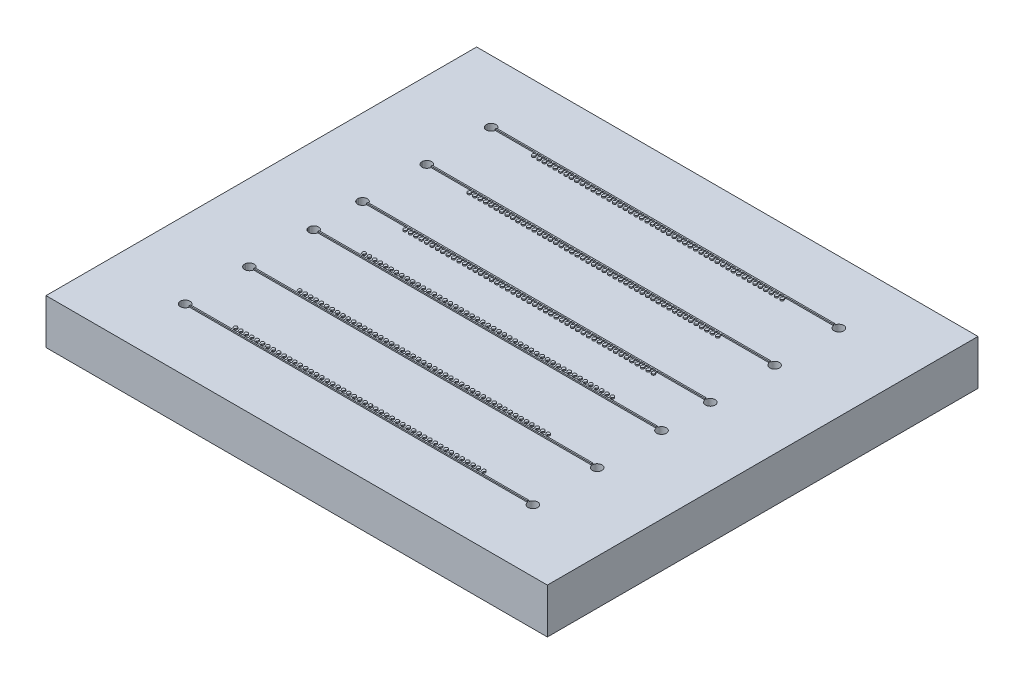
from build123d import *

# Parameters (mm, degrees)
SKETCH1_W            = 39
SKETCH1_H            = 33.5
BOSS_EXTRUDE1_DEPTH  = 3.5
BOSS_EXTRUDE3_DEPTH  = 0.1
CUT_EXTRUDE1_REACH   = 27.943
LPATTERN3_COUNT      = 3
LPATTERN3_PITCH      = 5
MIRROR1_COPY_1_DEPTH = 0.1
MIRROR1_COPY_2_DEPTH = 0.1
MIRROR1_COPY_3_REACH = 27.943
MIRROR1_COPY_4_REACH = 27.943
MIRROR1_COPY_5_DEPTH = 0.1
MIRROR1_COPY_6_REACH = 27.943


with BuildPart() as part:
    # Sketch1 → Boss-Extrude1 (new body)
    with BuildSketch(Plane(origin=(0, 0, 0), x_dir=(1, 0, 0), z_dir=(0, 1, 0))):
        Rectangle(SKETCH1_W, SKETCH1_H)
    extrude(amount=BOSS_EXTRUDE1_DEPTH)

    # Sketch2 → Boss-Extrude3 (add)
    with BuildSketch(Plane(origin=(0, 3.5, 0), x_dir=(1, 0, 0), z_dir=(0, 1, 0))):
        with BuildLine():
            Line((-9.02, 11.71), (-9.02, 11.85))
            Line((-9.02, 11.85), (-8.7, 11.85))
            Line((-8.7, 11.85), (-8.7, 11.71))
            ThreePointArc((-8.7, 11.71), (-8.65, 11.472527536), (-8.6, 11.71))
            Line((-8.6, 11.71), (-8.6, 11.85))
            Line((-8.6, 11.85), (-8.28, 11.85))
            Line((-8.28, 11.85), (-8.28, 11.71))
            ThreePointArc((-8.28, 11.71), (-8.23, 11.472527536), (-8.18, 11.71))
            Line((-8.18, 11.71), (-8.18, 11.85))
            Line((-8.18, 11.85), (-7.86, 11.85))
            Line((-7.86, 11.85), (-7.86, 11.71))
            ThreePointArc((-7.86, 11.71), (-7.81, 11.472527536), (-7.76, 11.71))
            Line((-7.76, 11.71), (-7.76, 11.85))
            Line((-7.76, 11.85), (-7.44, 11.85))
            Line((-7.44, 11.85), (-7.44, 11.71))
            ThreePointArc((-7.44, 11.71), (-7.39, 11.472527536), (-7.34, 11.71))
            Line((-7.34, 11.71), (-7.34, 11.85))
            Line((-7.34, 11.85), (-7.02, 11.85))
            Line((-7.02, 11.85), (-7.02, 11.71))
            ThreePointArc((-7.02, 11.71), (-6.97, 11.472527536), (-6.92, 11.71))
            Line((-6.92, 11.71), (-6.92, 11.85))
            Line((-6.92, 11.85), (-6.6, 11.85))
            Line((-6.6, 11.85), (-6.6, 11.71))
            ThreePointArc((-6.6, 11.71), (-6.55, 11.472527536), (-6.5, 11.71))
            Line((-6.5, 11.71), (-6.5, 11.85))
            Line((-6.5, 11.85), (-6.18, 11.85))
            Line((-6.18, 11.85), (-6.18, 11.71))
            ThreePointArc((-6.18, 11.71), (-6.13, 11.472527536), (-6.08, 11.71))
            Line((-6.08, 11.71), (-6.08, 11.85))
            Line((-6.08, 11.85), (-5.76, 11.85))
            Line((-5.76, 11.85), (-5.76, 11.71))
            ThreePointArc((-5.76, 11.71), (-5.71, 11.472527536), (-5.66, 11.71))
            Line((-5.66, 11.71), (-5.66, 11.85))
            Line((-5.66, 11.85), (-5.34, 11.85))
            Line((-5.34, 11.85), (-5.34, 11.71))
            ThreePointArc((-5.34, 11.71), (-5.29, 11.472527536), (-5.24, 11.71))
            Line((-5.24, 11.71), (-5.24, 11.85))
            Line((-5.24, 11.85), (-4.92, 11.85))
            Line((-4.92, 11.85), (-4.92, 11.71))
            ThreePointArc((-4.92, 11.71), (-4.87, 11.472527536), (-4.82, 11.71))
            Line((-4.82, 11.71), (-4.82, 11.85))
            Line((-4.82, 11.85), (-4.5, 11.85))
            Line((-4.5, 11.85), (-4.5, 11.71))
            ThreePointArc((-4.5, 11.71), (-4.45, 11.472527536), (-4.4, 11.71))
            Line((-4.4, 11.71), (-4.4, 11.85))
            Line((-4.4, 11.85), (-4.08, 11.85))
            Line((-4.08, 11.85), (-4.08, 11.71))
            ThreePointArc((-4.08, 11.71), (-4.03, 11.472527536), (-3.98, 11.71))
            Line((-3.98, 11.71), (-3.98, 11.85))
            Line((-3.98, 11.85), (-3.66, 11.85))
            Line((-3.66, 11.85), (-3.66, 11.71))
            ThreePointArc((-3.66, 11.71), (-3.61, 11.472527536), (-3.56, 11.71))
            Line((-3.56, 11.71), (-3.56, 11.85))
            Line((-3.56, 11.85), (-3.24, 11.85))
            Line((-3.24, 11.85), (-3.24, 11.71))
            ThreePointArc((-3.24, 11.71), (-3.19, 11.472527536), (-3.14, 11.71))
            Line((-3.14, 11.71), (-3.14, 11.85))
            Line((-3.14, 11.85), (-2.82, 11.85))
            Line((-2.82, 11.85), (-2.82, 11.71))
            ThreePointArc((-2.82, 11.71), (-2.77, 11.472527536), (-2.72, 11.71))
            Line((-2.72, 11.71), (-2.72, 11.85))
            Line((-2.72, 11.85), (-2.4, 11.85))
            Line((-2.4, 11.85), (-2.4, 11.71))
            ThreePointArc((-2.4, 11.71), (-2.35, 11.472527536), (-2.3, 11.71))
            Line((-2.3, 11.71), (-2.3, 11.85))
            Line((-2.3, 11.85), (-1.98, 11.85))
            Line((-1.98, 11.85), (-1.98, 11.71))
            ThreePointArc((-1.98, 11.71), (-1.93, 11.472527536), (-1.88, 11.71))
            Line((-1.88, 11.71), (-1.88, 11.85))
            Line((-1.88, 11.85), (-1.56, 11.85))
            Line((-1.56, 11.85), (-1.56, 11.71))
            ThreePointArc((-1.56, 11.71), (-1.51, 11.472527536), (-1.46, 11.71))
            Line((-1.46, 11.71), (-1.46, 11.85))
            Line((-1.46, 11.85), (-1.14, 11.85))
            Line((-1.14, 11.85), (-1.14, 11.71))
            ThreePointArc((-1.14, 11.71), (-1.09, 11.472527536), (-1.04, 11.71))
            Line((-1.04, 11.71), (-1.04, 11.85))
            Line((-1.04, 11.85), (-0.72, 11.85))
            Line((-0.72, 11.85), (-0.72, 11.71))
            ThreePointArc((-0.72, 11.71), (-0.67, 11.472527536), (-0.62, 11.71))
            Line((-0.62, 11.71), (-0.62, 11.85))
            Line((-0.62, 11.85), (-0.3, 11.85))
            Line((-0.3, 11.85), (-0.3, 11.71))
            ThreePointArc((-0.3, 11.71), (-0.25, 11.472527536), (-0.2, 11.71))
            Line((-0.2, 11.71), (-0.2, 11.85))
            Line((-0.2, 11.85), (0.12, 11.85))
            Line((0.12, 11.85), (0.12, 11.71))
            ThreePointArc((0.12, 11.71), (0.17, 11.472527536), (0.22, 11.71))
            Line((0.22, 11.71), (0.22, 11.85))
            Line((0.22, 11.85), (0.54, 11.85))
            Line((0.54, 11.85), (0.54, 11.71))
            ThreePointArc((0.54, 11.71), (0.59, 11.472527536), (0.64, 11.71))
            Line((0.64, 11.71), (0.64, 11.85))
            Line((0.64, 11.85), (0.96, 11.85))
            Line((0.96, 11.85), (0.96, 11.71))
            ThreePointArc((0.96, 11.71), (1.01, 11.472527536), (1.06, 11.71))
            Line((1.06, 11.71), (1.06, 11.85))
            Line((1.06, 11.85), (1.38, 11.85))
            Line((1.38, 11.85), (1.38, 11.71))
            ThreePointArc((1.38, 11.71), (1.43, 11.472527536), (1.48, 11.71))
            Line((1.48, 11.71), (1.48, 11.85))
            Line((1.48, 11.85), (1.8, 11.85))
            Line((1.8, 11.85), (1.8, 11.71))
            ThreePointArc((1.8, 11.71), (1.85, 11.472527536), (1.9, 11.71))
            Line((1.9, 11.71), (1.9, 11.85))
            Line((1.9, 11.85), (2.22, 11.85))
            Line((2.22, 11.85), (2.22, 11.71))
            ThreePointArc((2.22, 11.71), (2.27, 11.472527536), (2.32, 11.71))
            Line((2.32, 11.71), (2.32, 11.85))
            Line((2.32, 11.85), (2.64, 11.85))
            Line((2.64, 11.85), (2.64, 11.71))
            ThreePointArc((2.64, 11.71), (2.69, 11.472527536), (2.74, 11.71))
            Line((2.74, 11.71), (2.74, 11.85))
            Line((2.74, 11.85), (3.06, 11.85))
            Line((3.06, 11.85), (3.06, 11.71))
            ThreePointArc((3.06, 11.71), (3.11, 11.472527536), (3.16, 11.71))
            Line((3.16, 11.71), (3.16, 11.85))
            Line((3.16, 11.85), (3.48, 11.85))
            Line((3.48, 11.85), (3.48, 11.71))
            ThreePointArc((3.48, 11.71), (3.53, 11.472527536), (3.58, 11.71))
            Line((3.58, 11.71), (3.58, 11.85))
            Line((3.58, 11.85), (3.9, 11.85))
            Line((3.9, 11.85), (3.9, 11.71))
            ThreePointArc((3.9, 11.71), (3.95, 11.472527536), (4, 11.71))
            Line((4, 11.71), (4, 11.85))
            Line((4, 11.85), (4.32, 11.85))
            Line((4.32, 11.85), (4.32, 11.71))
            ThreePointArc((4.32, 11.71), (4.37, 11.472527536), (4.42, 11.71))
            Line((4.42, 11.71), (4.42, 11.85))
            Line((4.42, 11.85), (4.74, 11.85))
            Line((4.74, 11.85), (4.74, 11.71))
            ThreePointArc((4.74, 11.71), (4.79, 11.472527536), (4.84, 11.71))
            Line((4.84, 11.71), (4.84, 11.85))
            Line((4.84, 11.85), (5.16, 11.85))
            Line((5.16, 11.85), (5.16, 11.71))
            ThreePointArc((5.16, 11.71), (5.21, 11.472527536), (5.26, 11.71))
            Line((5.26, 11.71), (5.26, 11.85))
            Line((5.26, 11.85), (5.58, 11.85))
            Line((5.58, 11.85), (5.58, 11.71))
            ThreePointArc((5.58, 11.71), (5.63, 11.472527536), (5.68, 11.71))
            Line((5.68, 11.71), (5.68, 11.85))
            Line((5.68, 11.85), (6, 11.85))
            Line((6, 11.85), (6, 11.71))
            ThreePointArc((6, 11.71), (6.05, 11.472527536), (6.1, 11.71))
            Line((6.1, 11.71), (6.1, 11.85))
            Line((6.1, 11.85), (6.42, 11.85))
            Line((6.42, 11.85), (6.42, 11.71))
            ThreePointArc((6.42, 11.71), (6.47, 11.472527536), (6.52, 11.71))
            Line((6.52, 11.71), (6.52, 11.85))
            Line((6.52, 11.85), (6.84, 11.85))
            Line((6.84, 11.85), (6.84, 11.71))
            ThreePointArc((6.84, 11.71), (6.89, 11.472527536), (6.94, 11.71))
            Line((6.94, 11.71), (6.94, 11.85))
            Line((6.94, 11.85), (7.26, 11.85))
            Line((7.26, 11.85), (7.26, 11.71))
            ThreePointArc((7.26, 11.71), (7.31, 11.472527536), (7.36, 11.71))
            Line((7.36, 11.71), (7.36, 11.85))
            Line((7.36, 11.85), (7.68, 11.85))
            Line((7.68, 11.85), (7.68, 11.71))
            ThreePointArc((7.68, 11.71), (7.73, 11.472527536), (7.78, 11.71))
            Line((7.78, 11.71), (7.78, 11.85))
            Line((7.78, 11.85), (8.1, 11.85))
            Line((8.1, 11.85), (8.1, 11.71))
            ThreePointArc((8.1, 11.71), (8.15, 11.472527536), (8.2, 11.71))
            Line((8.2, 11.71), (8.2, 11.85))
            Line((8.2, 11.85), (8.52, 11.85))
            Line((8.52, 11.85), (8.52, 11.71))
            ThreePointArc((8.52, 11.71), (8.57, 11.472527536), (8.62, 11.71))
            Line((8.62, 11.71), (8.62, 11.85))
            Line((8.62, 11.85), (8.94, 11.85))
            Line((8.94, 11.85), (8.94, 11.71))
            ThreePointArc((8.94, 11.71), (8.99, 11.472527536), (9.04, 11.71))
            Line((9.04, 11.71), (9.04, 11.85))
            Line((9.04, 11.85), (9.36, 11.85))
            Line((9.36, 11.85), (9.36, 11.71))
            ThreePointArc((9.36, 11.71), (9.41, 11.472527536), (9.46, 11.71))
            Line((9.46, 11.71), (9.46, 11.85))
            Line((9.46, 11.85), (13.156696563, 11.85))
            ThreePointArc((13.156696563, 11.85), (13.153348281, 11.9), (13.156696563, 11.95))
            Line((13.156696563, 11.95), (-13.156696563, 11.95))
            ThreePointArc((-13.156696563, 11.95), (-13.154186288, 11.925055992), (-13.153348281, 11.9))
            ThreePointArc((-13.153348281, 11.9), (-13.154186288, 11.874944008), (-13.156696563, 11.85))
            Line((-13.156696563, 11.85), (-9.96, 11.85))
            Line((-9.96, 11.85), (-9.96, 11.71))
            ThreePointArc((-9.96, 11.71), (-9.91, 11.472527536), (-9.86, 11.71))
            Line((-9.86, 11.71), (-9.86, 11.85))
            Line((-9.86, 11.85), (-9.54, 11.85))
            Line((-9.54, 11.85), (-9.54, 11.71))
            ThreePointArc((-9.54, 11.71), (-9.49, 11.472527536), (-9.44, 11.71))
            Line((-9.44, 11.71), (-9.44, 11.85))
            Line((-9.44, 11.85), (-9.12, 11.85))
            Line((-9.12, 11.85), (-9.12, 11.71))
            ThreePointArc((-9.12, 11.71), (-9.07, 11.472527536), (-9.02, 11.71))
        make_face()
    boss_extrude3 = extrude(amount=BOSS_EXTRUDE3_DEPTH)

    # Sketch2<9> → Cut-Extrude1 (cut, up to next)
    with BuildSketch(Plane(origin=(0, 3.5, 0), x_dir=(1, 0, 0), z_dir=(0, 1, 0)), mode=Mode.PRIVATE) as cut_extrude1_sk1:
        with BuildLine():
            ThreePointArc((-13.9, 11.85), (-13.153348281, 11.9), (-13.9, 11.95))
            Line((-13.9, 11.95), (-13.9, 11.85))
        make_face()
    cut_extrude1_tool1 = extrude(cut_extrude1_sk1.sketch, amount=-CUT_EXTRUDE1_REACH, mode=Mode.PRIVATE) & part.part
    # Sketch2<9> → Cut-Extrude1 (cut, up to next)
    with BuildSketch(Plane(origin=(0, 3.5, 0), x_dir=(1, 0, 0), z_dir=(0, 1, 0)), mode=Mode.PRIVATE) as cut_extrude1_sk2:
        with BuildLine():
            ThreePointArc((13.9, 11.95), (13.153348281, 11.9), (13.9, 11.85))
            Line((13.9, 11.85), (13.9, 11.95))
        make_face()
    cut_extrude1_tool2 = extrude(cut_extrude1_sk2.sketch, amount=-CUT_EXTRUDE1_REACH, mode=Mode.PRIVATE) & part.part
    cut_extrude1_1 = cut_extrude1_tool1.solids().sort_by_distance((-13.52816, 3.5, -11.9))[0]
    add(cut_extrude1_1, mode=Mode.SUBTRACT)
    cut_extrude1_2 = cut_extrude1_tool2.solids().sort_by_distance((13.52816, 3.5, -11.9))[0]
    add(cut_extrude1_2, mode=Mode.SUBTRACT)
    cut_extrude1 = cut_extrude1_1 + cut_extrude1_2  # Cut-Extrude1 as one shape, for the pattern or mirror that repeats it

    # LPattern3: Boss-Extrude3, Cut-Extrude1 ×3
    with Locations(*[(0, 0, i * LPATTERN3_PITCH) for i in range(1, LPATTERN3_COUNT)]):
        add(boss_extrude3)
        add(cut_extrude1, mode=Mode.SUBTRACT)

    # Mirror1 copy 1 sketch → Mirror1 copy 1 (add)
    with BuildSketch(Plane(origin=(0, 3.5, -5), x_dir=(1, 0, 0), z_dir=(0, 1, 0))):
        with BuildLine():
            Line((-9.02, -11.71), (-9.02, -11.85))
            Line((-9.02, -11.85), (-8.7, -11.85))
            Line((-8.7, -11.85), (-8.7, -11.71))
            ThreePointArc((-8.7, -11.71), (-8.65, -11.472527536), (-8.6, -11.71))
            Line((-8.6, -11.71), (-8.6, -11.85))
            Line((-8.6, -11.85), (-8.28, -11.85))
            Line((-8.28, -11.85), (-8.28, -11.71))
            ThreePointArc((-8.28, -11.71), (-8.23, -11.472527536), (-8.18, -11.71))
            Line((-8.18, -11.71), (-8.18, -11.85))
            Line((-8.18, -11.85), (-7.86, -11.85))
            Line((-7.86, -11.85), (-7.86, -11.71))
            ThreePointArc((-7.86, -11.71), (-7.81, -11.472527536), (-7.76, -11.71))
            Line((-7.76, -11.71), (-7.76, -11.85))
            Line((-7.76, -11.85), (-7.44, -11.85))
            Line((-7.44, -11.85), (-7.44, -11.71))
            ThreePointArc((-7.44, -11.71), (-7.39, -11.472527536), (-7.34, -11.71))
            Line((-7.34, -11.71), (-7.34, -11.85))
            Line((-7.34, -11.85), (-7.02, -11.85))
            Line((-7.02, -11.85), (-7.02, -11.71))
            ThreePointArc((-7.02, -11.71), (-6.97, -11.472527536), (-6.92, -11.71))
            Line((-6.92, -11.71), (-6.92, -11.85))
            Line((-6.92, -11.85), (-6.6, -11.85))
            Line((-6.6, -11.85), (-6.6, -11.71))
            ThreePointArc((-6.6, -11.71), (-6.55, -11.472527536), (-6.5, -11.71))
            Line((-6.5, -11.71), (-6.5, -11.85))
            Line((-6.5, -11.85), (-6.18, -11.85))
            Line((-6.18, -11.85), (-6.18, -11.71))
            ThreePointArc((-6.18, -11.71), (-6.13, -11.472527536), (-6.08, -11.71))
            Line((-6.08, -11.71), (-6.08, -11.85))
            Line((-6.08, -11.85), (-5.76, -11.85))
            Line((-5.76, -11.85), (-5.76, -11.71))
            ThreePointArc((-5.76, -11.71), (-5.71, -11.472527536), (-5.66, -11.71))
            Line((-5.66, -11.71), (-5.66, -11.85))
            Line((-5.66, -11.85), (-5.34, -11.85))
            Line((-5.34, -11.85), (-5.34, -11.71))
            ThreePointArc((-5.34, -11.71), (-5.29, -11.472527536), (-5.24, -11.71))
            Line((-5.24, -11.71), (-5.24, -11.85))
            Line((-5.24, -11.85), (-4.92, -11.85))
            Line((-4.92, -11.85), (-4.92, -11.71))
            ThreePointArc((-4.92, -11.71), (-4.87, -11.472527536), (-4.82, -11.71))
            Line((-4.82, -11.71), (-4.82, -11.85))
            Line((-4.82, -11.85), (-4.5, -11.85))
            Line((-4.5, -11.85), (-4.5, -11.71))
            ThreePointArc((-4.5, -11.71), (-4.45, -11.472527536), (-4.4, -11.71))
            Line((-4.4, -11.71), (-4.4, -11.85))
            Line((-4.4, -11.85), (-4.08, -11.85))
            Line((-4.08, -11.85), (-4.08, -11.71))
            ThreePointArc((-4.08, -11.71), (-4.03, -11.472527536), (-3.98, -11.71))
            Line((-3.98, -11.71), (-3.98, -11.85))
            Line((-3.98, -11.85), (-3.66, -11.85))
            Line((-3.66, -11.85), (-3.66, -11.71))
            ThreePointArc((-3.66, -11.71), (-3.61, -11.472527536), (-3.56, -11.71))
            Line((-3.56, -11.71), (-3.56, -11.85))
            Line((-3.56, -11.85), (-3.24, -11.85))
            Line((-3.24, -11.85), (-3.24, -11.71))
            ThreePointArc((-3.24, -11.71), (-3.19, -11.472527536), (-3.14, -11.71))
            Line((-3.14, -11.71), (-3.14, -11.85))
            Line((-3.14, -11.85), (-2.82, -11.85))
            Line((-2.82, -11.85), (-2.82, -11.71))
            ThreePointArc((-2.82, -11.71), (-2.77, -11.472527536), (-2.72, -11.71))
            Line((-2.72, -11.71), (-2.72, -11.85))
            Line((-2.72, -11.85), (-2.4, -11.85))
            Line((-2.4, -11.85), (-2.4, -11.71))
            ThreePointArc((-2.4, -11.71), (-2.35, -11.472527536), (-2.3, -11.71))
            Line((-2.3, -11.71), (-2.3, -11.85))
            Line((-2.3, -11.85), (-1.98, -11.85))
            Line((-1.98, -11.85), (-1.98, -11.71))
            ThreePointArc((-1.98, -11.71), (-1.93, -11.472527536), (-1.88, -11.71))
            Line((-1.88, -11.71), (-1.88, -11.85))
            Line((-1.88, -11.85), (-1.56, -11.85))
            Line((-1.56, -11.85), (-1.56, -11.71))
            ThreePointArc((-1.56, -11.71), (-1.51, -11.472527536), (-1.46, -11.71))
            Line((-1.46, -11.71), (-1.46, -11.85))
            Line((-1.46, -11.85), (-1.14, -11.85))
            Line((-1.14, -11.85), (-1.14, -11.71))
            ThreePointArc((-1.14, -11.71), (-1.09, -11.472527536), (-1.04, -11.71))
            Line((-1.04, -11.71), (-1.04, -11.85))
            Line((-1.04, -11.85), (-0.72, -11.85))
            Line((-0.72, -11.85), (-0.72, -11.71))
            ThreePointArc((-0.72, -11.71), (-0.67, -11.472527536), (-0.62, -11.71))
            Line((-0.62, -11.71), (-0.62, -11.85))
            Line((-0.62, -11.85), (-0.3, -11.85))
            Line((-0.3, -11.85), (-0.3, -11.71))
            ThreePointArc((-0.3, -11.71), (-0.25, -11.472527536), (-0.2, -11.71))
            Line((-0.2, -11.71), (-0.2, -11.85))
            Line((-0.2, -11.85), (0.12, -11.85))
            Line((0.12, -11.85), (0.12, -11.71))
            ThreePointArc((0.12, -11.71), (0.17, -11.472527536), (0.22, -11.71))
            Line((0.22, -11.71), (0.22, -11.85))
            Line((0.22, -11.85), (0.54, -11.85))
            Line((0.54, -11.85), (0.54, -11.71))
            ThreePointArc((0.54, -11.71), (0.59, -11.472527536), (0.64, -11.71))
            Line((0.64, -11.71), (0.64, -11.85))
            Line((0.64, -11.85), (0.96, -11.85))
            Line((0.96, -11.85), (0.96, -11.71))
            ThreePointArc((0.96, -11.71), (1.01, -11.472527536), (1.06, -11.71))
            Line((1.06, -11.71), (1.06, -11.85))
            Line((1.06, -11.85), (1.38, -11.85))
            Line((1.38, -11.85), (1.38, -11.71))
            ThreePointArc((1.38, -11.71), (1.43, -11.472527536), (1.48, -11.71))
            Line((1.48, -11.71), (1.48, -11.85))
            Line((1.48, -11.85), (1.8, -11.85))
            Line((1.8, -11.85), (1.8, -11.71))
            ThreePointArc((1.8, -11.71), (1.85, -11.472527536), (1.9, -11.71))
            Line((1.9, -11.71), (1.9, -11.85))
            Line((1.9, -11.85), (2.22, -11.85))
            Line((2.22, -11.85), (2.22, -11.71))
            ThreePointArc((2.22, -11.71), (2.27, -11.472527536), (2.32, -11.71))
            Line((2.32, -11.71), (2.32, -11.85))
            Line((2.32, -11.85), (2.64, -11.85))
            Line((2.64, -11.85), (2.64, -11.71))
            ThreePointArc((2.64, -11.71), (2.69, -11.472527536), (2.74, -11.71))
            Line((2.74, -11.71), (2.74, -11.85))
            Line((2.74, -11.85), (3.06, -11.85))
            Line((3.06, -11.85), (3.06, -11.71))
            ThreePointArc((3.06, -11.71), (3.11, -11.472527536), (3.16, -11.71))
            Line((3.16, -11.71), (3.16, -11.85))
            Line((3.16, -11.85), (3.48, -11.85))
            Line((3.48, -11.85), (3.48, -11.71))
            ThreePointArc((3.48, -11.71), (3.53, -11.472527536), (3.58, -11.71))
            Line((3.58, -11.71), (3.58, -11.85))
            Line((3.58, -11.85), (3.9, -11.85))
            Line((3.9, -11.85), (3.9, -11.71))
            ThreePointArc((3.9, -11.71), (3.95, -11.472527536), (4, -11.71))
            Line((4, -11.71), (4, -11.85))
            Line((4, -11.85), (4.32, -11.85))
            Line((4.32, -11.85), (4.32, -11.71))
            ThreePointArc((4.32, -11.71), (4.37, -11.472527536), (4.42, -11.71))
            Line((4.42, -11.71), (4.42, -11.85))
            Line((4.42, -11.85), (4.74, -11.85))
            Line((4.74, -11.85), (4.74, -11.71))
            ThreePointArc((4.74, -11.71), (4.79, -11.472527536), (4.84, -11.71))
            Line((4.84, -11.71), (4.84, -11.85))
            Line((4.84, -11.85), (5.16, -11.85))
            Line((5.16, -11.85), (5.16, -11.71))
            ThreePointArc((5.16, -11.71), (5.21, -11.472527536), (5.26, -11.71))
            Line((5.26, -11.71), (5.26, -11.85))
            Line((5.26, -11.85), (5.58, -11.85))
            Line((5.58, -11.85), (5.58, -11.71))
            ThreePointArc((5.58, -11.71), (5.63, -11.472527536), (5.68, -11.71))
            Line((5.68, -11.71), (5.68, -11.85))
            Line((5.68, -11.85), (6, -11.85))
            Line((6, -11.85), (6, -11.71))
            ThreePointArc((6, -11.71), (6.05, -11.472527536), (6.1, -11.71))
            Line((6.1, -11.71), (6.1, -11.85))
            Line((6.1, -11.85), (6.42, -11.85))
            Line((6.42, -11.85), (6.42, -11.71))
            ThreePointArc((6.42, -11.71), (6.47, -11.472527536), (6.52, -11.71))
            Line((6.52, -11.71), (6.52, -11.85))
            Line((6.52, -11.85), (6.84, -11.85))
            Line((6.84, -11.85), (6.84, -11.71))
            ThreePointArc((6.84, -11.71), (6.89, -11.472527536), (6.94, -11.71))
            Line((6.94, -11.71), (6.94, -11.85))
            Line((6.94, -11.85), (7.26, -11.85))
            Line((7.26, -11.85), (7.26, -11.71))
            ThreePointArc((7.26, -11.71), (7.31, -11.472527536), (7.36, -11.71))
            Line((7.36, -11.71), (7.36, -11.85))
            Line((7.36, -11.85), (7.68, -11.85))
            Line((7.68, -11.85), (7.68, -11.71))
            ThreePointArc((7.68, -11.71), (7.73, -11.472527536), (7.78, -11.71))
            Line((7.78, -11.71), (7.78, -11.85))
            Line((7.78, -11.85), (8.1, -11.85))
            Line((8.1, -11.85), (8.1, -11.71))
            ThreePointArc((8.1, -11.71), (8.15, -11.472527536), (8.2, -11.71))
            Line((8.2, -11.71), (8.2, -11.85))
            Line((8.2, -11.85), (8.52, -11.85))
            Line((8.52, -11.85), (8.52, -11.71))
            ThreePointArc((8.52, -11.71), (8.57, -11.472527536), (8.62, -11.71))
            Line((8.62, -11.71), (8.62, -11.85))
            Line((8.62, -11.85), (8.94, -11.85))
            Line((8.94, -11.85), (8.94, -11.71))
            ThreePointArc((8.94, -11.71), (8.99, -11.472527536), (9.04, -11.71))
            Line((9.04, -11.71), (9.04, -11.85))
            Line((9.04, -11.85), (9.36, -11.85))
            Line((9.36, -11.85), (9.36, -11.71))
            ThreePointArc((9.36, -11.71), (9.41, -11.472527536), (9.46, -11.71))
            Line((9.46, -11.71), (9.46, -11.85))
            Line((9.46, -11.85), (13.156696563, -11.85))
            ThreePointArc((13.156696563, -11.85), (13.153348281, -11.9), (13.156696563, -11.95))
            Line((13.156696563, -11.95), (-13.156696563, -11.95))
            ThreePointArc((-13.156696563, -11.95), (-13.154186288, -11.925055992), (-13.153348281, -11.9))
            ThreePointArc((-13.153348281, -11.9), (-13.154186288, -11.874944008), (-13.156696563, -11.85))
            Line((-13.156696563, -11.85), (-9.96, -11.85))
            Line((-9.96, -11.85), (-9.96, -11.71))
            ThreePointArc((-9.96, -11.71), (-9.91, -11.472527536), (-9.86, -11.71))
            Line((-9.86, -11.71), (-9.86, -11.85))
            Line((-9.86, -11.85), (-9.54, -11.85))
            Line((-9.54, -11.85), (-9.54, -11.71))
            ThreePointArc((-9.54, -11.71), (-9.49, -11.472527536), (-9.44, -11.71))
            Line((-9.44, -11.71), (-9.44, -11.85))
            Line((-9.44, -11.85), (-9.12, -11.85))
            Line((-9.12, -11.85), (-9.12, -11.71))
            ThreePointArc((-9.12, -11.71), (-9.07, -11.472527536), (-9.02, -11.71))
        make_face()
    extrude(amount=MIRROR1_COPY_1_DEPTH)

    # Mirror1 copy 2 sketch → Mirror1 copy 2 (add)
    with BuildSketch(Plane(origin=(0, 3.5, -10), x_dir=(1, 0, 0), z_dir=(0, 1, 0))):
        with BuildLine():
            Line((-9.02, -11.71), (-9.02, -11.85))
            Line((-9.02, -11.85), (-8.7, -11.85))
            Line((-8.7, -11.85), (-8.7, -11.71))
            ThreePointArc((-8.7, -11.71), (-8.65, -11.472527536), (-8.6, -11.71))
            Line((-8.6, -11.71), (-8.6, -11.85))
            Line((-8.6, -11.85), (-8.28, -11.85))
            Line((-8.28, -11.85), (-8.28, -11.71))
            ThreePointArc((-8.28, -11.71), (-8.23, -11.472527536), (-8.18, -11.71))
            Line((-8.18, -11.71), (-8.18, -11.85))
            Line((-8.18, -11.85), (-7.86, -11.85))
            Line((-7.86, -11.85), (-7.86, -11.71))
            ThreePointArc((-7.86, -11.71), (-7.81, -11.472527536), (-7.76, -11.71))
            Line((-7.76, -11.71), (-7.76, -11.85))
            Line((-7.76, -11.85), (-7.44, -11.85))
            Line((-7.44, -11.85), (-7.44, -11.71))
            ThreePointArc((-7.44, -11.71), (-7.39, -11.472527536), (-7.34, -11.71))
            Line((-7.34, -11.71), (-7.34, -11.85))
            Line((-7.34, -11.85), (-7.02, -11.85))
            Line((-7.02, -11.85), (-7.02, -11.71))
            ThreePointArc((-7.02, -11.71), (-6.97, -11.472527536), (-6.92, -11.71))
            Line((-6.92, -11.71), (-6.92, -11.85))
            Line((-6.92, -11.85), (-6.6, -11.85))
            Line((-6.6, -11.85), (-6.6, -11.71))
            ThreePointArc((-6.6, -11.71), (-6.55, -11.472527536), (-6.5, -11.71))
            Line((-6.5, -11.71), (-6.5, -11.85))
            Line((-6.5, -11.85), (-6.18, -11.85))
            Line((-6.18, -11.85), (-6.18, -11.71))
            ThreePointArc((-6.18, -11.71), (-6.13, -11.472527536), (-6.08, -11.71))
            Line((-6.08, -11.71), (-6.08, -11.85))
            Line((-6.08, -11.85), (-5.76, -11.85))
            Line((-5.76, -11.85), (-5.76, -11.71))
            ThreePointArc((-5.76, -11.71), (-5.71, -11.472527536), (-5.66, -11.71))
            Line((-5.66, -11.71), (-5.66, -11.85))
            Line((-5.66, -11.85), (-5.34, -11.85))
            Line((-5.34, -11.85), (-5.34, -11.71))
            ThreePointArc((-5.34, -11.71), (-5.29, -11.472527536), (-5.24, -11.71))
            Line((-5.24, -11.71), (-5.24, -11.85))
            Line((-5.24, -11.85), (-4.92, -11.85))
            Line((-4.92, -11.85), (-4.92, -11.71))
            ThreePointArc((-4.92, -11.71), (-4.87, -11.472527536), (-4.82, -11.71))
            Line((-4.82, -11.71), (-4.82, -11.85))
            Line((-4.82, -11.85), (-4.5, -11.85))
            Line((-4.5, -11.85), (-4.5, -11.71))
            ThreePointArc((-4.5, -11.71), (-4.45, -11.472527536), (-4.4, -11.71))
            Line((-4.4, -11.71), (-4.4, -11.85))
            Line((-4.4, -11.85), (-4.08, -11.85))
            Line((-4.08, -11.85), (-4.08, -11.71))
            ThreePointArc((-4.08, -11.71), (-4.03, -11.472527536), (-3.98, -11.71))
            Line((-3.98, -11.71), (-3.98, -11.85))
            Line((-3.98, -11.85), (-3.66, -11.85))
            Line((-3.66, -11.85), (-3.66, -11.71))
            ThreePointArc((-3.66, -11.71), (-3.61, -11.472527536), (-3.56, -11.71))
            Line((-3.56, -11.71), (-3.56, -11.85))
            Line((-3.56, -11.85), (-3.24, -11.85))
            Line((-3.24, -11.85), (-3.24, -11.71))
            ThreePointArc((-3.24, -11.71), (-3.19, -11.472527536), (-3.14, -11.71))
            Line((-3.14, -11.71), (-3.14, -11.85))
            Line((-3.14, -11.85), (-2.82, -11.85))
            Line((-2.82, -11.85), (-2.82, -11.71))
            ThreePointArc((-2.82, -11.71), (-2.77, -11.472527536), (-2.72, -11.71))
            Line((-2.72, -11.71), (-2.72, -11.85))
            Line((-2.72, -11.85), (-2.4, -11.85))
            Line((-2.4, -11.85), (-2.4, -11.71))
            ThreePointArc((-2.4, -11.71), (-2.35, -11.472527536), (-2.3, -11.71))
            Line((-2.3, -11.71), (-2.3, -11.85))
            Line((-2.3, -11.85), (-1.98, -11.85))
            Line((-1.98, -11.85), (-1.98, -11.71))
            ThreePointArc((-1.98, -11.71), (-1.93, -11.472527536), (-1.88, -11.71))
            Line((-1.88, -11.71), (-1.88, -11.85))
            Line((-1.88, -11.85), (-1.56, -11.85))
            Line((-1.56, -11.85), (-1.56, -11.71))
            ThreePointArc((-1.56, -11.71), (-1.51, -11.472527536), (-1.46, -11.71))
            Line((-1.46, -11.71), (-1.46, -11.85))
            Line((-1.46, -11.85), (-1.14, -11.85))
            Line((-1.14, -11.85), (-1.14, -11.71))
            ThreePointArc((-1.14, -11.71), (-1.09, -11.472527536), (-1.04, -11.71))
            Line((-1.04, -11.71), (-1.04, -11.85))
            Line((-1.04, -11.85), (-0.72, -11.85))
            Line((-0.72, -11.85), (-0.72, -11.71))
            ThreePointArc((-0.72, -11.71), (-0.67, -11.472527536), (-0.62, -11.71))
            Line((-0.62, -11.71), (-0.62, -11.85))
            Line((-0.62, -11.85), (-0.3, -11.85))
            Line((-0.3, -11.85), (-0.3, -11.71))
            ThreePointArc((-0.3, -11.71), (-0.25, -11.472527536), (-0.2, -11.71))
            Line((-0.2, -11.71), (-0.2, -11.85))
            Line((-0.2, -11.85), (0.12, -11.85))
            Line((0.12, -11.85), (0.12, -11.71))
            ThreePointArc((0.12, -11.71), (0.17, -11.472527536), (0.22, -11.71))
            Line((0.22, -11.71), (0.22, -11.85))
            Line((0.22, -11.85), (0.54, -11.85))
            Line((0.54, -11.85), (0.54, -11.71))
            ThreePointArc((0.54, -11.71), (0.59, -11.472527536), (0.64, -11.71))
            Line((0.64, -11.71), (0.64, -11.85))
            Line((0.64, -11.85), (0.96, -11.85))
            Line((0.96, -11.85), (0.96, -11.71))
            ThreePointArc((0.96, -11.71), (1.01, -11.472527536), (1.06, -11.71))
            Line((1.06, -11.71), (1.06, -11.85))
            Line((1.06, -11.85), (1.38, -11.85))
            Line((1.38, -11.85), (1.38, -11.71))
            ThreePointArc((1.38, -11.71), (1.43, -11.472527536), (1.48, -11.71))
            Line((1.48, -11.71), (1.48, -11.85))
            Line((1.48, -11.85), (1.8, -11.85))
            Line((1.8, -11.85), (1.8, -11.71))
            ThreePointArc((1.8, -11.71), (1.85, -11.472527536), (1.9, -11.71))
            Line((1.9, -11.71), (1.9, -11.85))
            Line((1.9, -11.85), (2.22, -11.85))
            Line((2.22, -11.85), (2.22, -11.71))
            ThreePointArc((2.22, -11.71), (2.27, -11.472527536), (2.32, -11.71))
            Line((2.32, -11.71), (2.32, -11.85))
            Line((2.32, -11.85), (2.64, -11.85))
            Line((2.64, -11.85), (2.64, -11.71))
            ThreePointArc((2.64, -11.71), (2.69, -11.472527536), (2.74, -11.71))
            Line((2.74, -11.71), (2.74, -11.85))
            Line((2.74, -11.85), (3.06, -11.85))
            Line((3.06, -11.85), (3.06, -11.71))
            ThreePointArc((3.06, -11.71), (3.11, -11.472527536), (3.16, -11.71))
            Line((3.16, -11.71), (3.16, -11.85))
            Line((3.16, -11.85), (3.48, -11.85))
            Line((3.48, -11.85), (3.48, -11.71))
            ThreePointArc((3.48, -11.71), (3.53, -11.472527536), (3.58, -11.71))
            Line((3.58, -11.71), (3.58, -11.85))
            Line((3.58, -11.85), (3.9, -11.85))
            Line((3.9, -11.85), (3.9, -11.71))
            ThreePointArc((3.9, -11.71), (3.95, -11.472527536), (4, -11.71))
            Line((4, -11.71), (4, -11.85))
            Line((4, -11.85), (4.32, -11.85))
            Line((4.32, -11.85), (4.32, -11.71))
            ThreePointArc((4.32, -11.71), (4.37, -11.472527536), (4.42, -11.71))
            Line((4.42, -11.71), (4.42, -11.85))
            Line((4.42, -11.85), (4.74, -11.85))
            Line((4.74, -11.85), (4.74, -11.71))
            ThreePointArc((4.74, -11.71), (4.79, -11.472527536), (4.84, -11.71))
            Line((4.84, -11.71), (4.84, -11.85))
            Line((4.84, -11.85), (5.16, -11.85))
            Line((5.16, -11.85), (5.16, -11.71))
            ThreePointArc((5.16, -11.71), (5.21, -11.472527536), (5.26, -11.71))
            Line((5.26, -11.71), (5.26, -11.85))
            Line((5.26, -11.85), (5.58, -11.85))
            Line((5.58, -11.85), (5.58, -11.71))
            ThreePointArc((5.58, -11.71), (5.63, -11.472527536), (5.68, -11.71))
            Line((5.68, -11.71), (5.68, -11.85))
            Line((5.68, -11.85), (6, -11.85))
            Line((6, -11.85), (6, -11.71))
            ThreePointArc((6, -11.71), (6.05, -11.472527536), (6.1, -11.71))
            Line((6.1, -11.71), (6.1, -11.85))
            Line((6.1, -11.85), (6.42, -11.85))
            Line((6.42, -11.85), (6.42, -11.71))
            ThreePointArc((6.42, -11.71), (6.47, -11.472527536), (6.52, -11.71))
            Line((6.52, -11.71), (6.52, -11.85))
            Line((6.52, -11.85), (6.84, -11.85))
            Line((6.84, -11.85), (6.84, -11.71))
            ThreePointArc((6.84, -11.71), (6.89, -11.472527536), (6.94, -11.71))
            Line((6.94, -11.71), (6.94, -11.85))
            Line((6.94, -11.85), (7.26, -11.85))
            Line((7.26, -11.85), (7.26, -11.71))
            ThreePointArc((7.26, -11.71), (7.31, -11.472527536), (7.36, -11.71))
            Line((7.36, -11.71), (7.36, -11.85))
            Line((7.36, -11.85), (7.68, -11.85))
            Line((7.68, -11.85), (7.68, -11.71))
            ThreePointArc((7.68, -11.71), (7.73, -11.472527536), (7.78, -11.71))
            Line((7.78, -11.71), (7.78, -11.85))
            Line((7.78, -11.85), (8.1, -11.85))
            Line((8.1, -11.85), (8.1, -11.71))
            ThreePointArc((8.1, -11.71), (8.15, -11.472527536), (8.2, -11.71))
            Line((8.2, -11.71), (8.2, -11.85))
            Line((8.2, -11.85), (8.52, -11.85))
            Line((8.52, -11.85), (8.52, -11.71))
            ThreePointArc((8.52, -11.71), (8.57, -11.472527536), (8.62, -11.71))
            Line((8.62, -11.71), (8.62, -11.85))
            Line((8.62, -11.85), (8.94, -11.85))
            Line((8.94, -11.85), (8.94, -11.71))
            ThreePointArc((8.94, -11.71), (8.99, -11.472527536), (9.04, -11.71))
            Line((9.04, -11.71), (9.04, -11.85))
            Line((9.04, -11.85), (9.36, -11.85))
            Line((9.36, -11.85), (9.36, -11.71))
            ThreePointArc((9.36, -11.71), (9.41, -11.472527536), (9.46, -11.71))
            Line((9.46, -11.71), (9.46, -11.85))
            Line((9.46, -11.85), (13.156696563, -11.85))
            ThreePointArc((13.156696563, -11.85), (13.153348281, -11.9), (13.156696563, -11.95))
            Line((13.156696563, -11.95), (-13.156696563, -11.95))
            ThreePointArc((-13.156696563, -11.95), (-13.154186288, -11.925055992), (-13.153348281, -11.9))
            ThreePointArc((-13.153348281, -11.9), (-13.154186288, -11.874944008), (-13.156696563, -11.85))
            Line((-13.156696563, -11.85), (-9.96, -11.85))
            Line((-9.96, -11.85), (-9.96, -11.71))
            ThreePointArc((-9.96, -11.71), (-9.91, -11.472527536), (-9.86, -11.71))
            Line((-9.86, -11.71), (-9.86, -11.85))
            Line((-9.86, -11.85), (-9.54, -11.85))
            Line((-9.54, -11.85), (-9.54, -11.71))
            ThreePointArc((-9.54, -11.71), (-9.49, -11.472527536), (-9.44, -11.71))
            Line((-9.44, -11.71), (-9.44, -11.85))
            Line((-9.44, -11.85), (-9.12, -11.85))
            Line((-9.12, -11.85), (-9.12, -11.71))
            ThreePointArc((-9.12, -11.71), (-9.07, -11.472527536), (-9.02, -11.71))
        make_face()
    extrude(amount=MIRROR1_COPY_2_DEPTH)

    # Mirror1 copy 3 sketch → Mirror1 copy 3 (cut, up to next)
    with BuildSketch(Plane(origin=(0, 3.5, -5), x_dir=(1, 0, 0), z_dir=(0, 1, 0)), mode=Mode.PRIVATE) as mirror1_copy_3_sk1:
        with BuildLine():
            ThreePointArc((-13.9, -11.85), (-13.153348281, -11.9), (-13.9, -11.95))
            Line((-13.9, -11.95), (-13.9, -11.85))
        make_face()
    mirror1_copy_3_tool1 = extrude(mirror1_copy_3_sk1.sketch, amount=-MIRROR1_COPY_3_REACH, mode=Mode.PRIVATE) & part.part
    # Mirror1 copy 3 sketch → Mirror1 copy 3 (cut, up to next)
    with BuildSketch(Plane(origin=(0, 3.5, -5), x_dir=(1, 0, 0), z_dir=(0, 1, 0)), mode=Mode.PRIVATE) as mirror1_copy_3_sk2:
        with BuildLine():
            ThreePointArc((13.9, -11.95), (13.153348281, -11.9), (13.9, -11.85))
            Line((13.9, -11.85), (13.9, -11.95))
        make_face()
    mirror1_copy_3_tool2 = extrude(mirror1_copy_3_sk2.sketch, amount=-MIRROR1_COPY_3_REACH, mode=Mode.PRIVATE) & part.part
    add(mirror1_copy_3_tool1.solids().sort_by_distance((-13.52816, 3.5, 6.9))[0], mode=Mode.SUBTRACT)
    add(mirror1_copy_3_tool2.solids().sort_by_distance((13.52816, 3.5, 6.9))[0], mode=Mode.SUBTRACT)

    # Mirror1 copy 4 sketch → Mirror1 copy 4 (cut, up to next)
    with BuildSketch(Plane(origin=(0, 3.5, -10), x_dir=(1, 0, 0), z_dir=(0, 1, 0)), mode=Mode.PRIVATE) as mirror1_copy_4_sk1:
        with BuildLine():
            ThreePointArc((-13.9, -11.85), (-13.153348281, -11.9), (-13.9, -11.95))
            Line((-13.9, -11.95), (-13.9, -11.85))
        make_face()
    mirror1_copy_4_tool1 = extrude(mirror1_copy_4_sk1.sketch, amount=-MIRROR1_COPY_4_REACH, mode=Mode.PRIVATE) & part.part
    # Mirror1 copy 4 sketch → Mirror1 copy 4 (cut, up to next)
    with BuildSketch(Plane(origin=(0, 3.5, -10), x_dir=(1, 0, 0), z_dir=(0, 1, 0)), mode=Mode.PRIVATE) as mirror1_copy_4_sk2:
        with BuildLine():
            ThreePointArc((13.9, -11.95), (13.153348281, -11.9), (13.9, -11.85))
            Line((13.9, -11.85), (13.9, -11.95))
        make_face()
    mirror1_copy_4_tool2 = extrude(mirror1_copy_4_sk2.sketch, amount=-MIRROR1_COPY_4_REACH, mode=Mode.PRIVATE) & part.part
    add(mirror1_copy_4_tool1.solids().sort_by_distance((-13.52816, 3.5, 1.9))[0], mode=Mode.SUBTRACT)
    add(mirror1_copy_4_tool2.solids().sort_by_distance((13.52816, 3.5, 1.9))[0], mode=Mode.SUBTRACT)

    # Mirror1 copy 5 sketch → Mirror1 copy 5 (add)
    with BuildSketch(Plane(origin=(0, 3.5, 0), x_dir=(1, 0, 0), z_dir=(0, 1, 0))):
        with BuildLine():
            Line((-9.02, -11.71), (-9.02, -11.85))
            Line((-9.02, -11.85), (-8.7, -11.85))
            Line((-8.7, -11.85), (-8.7, -11.71))
            ThreePointArc((-8.7, -11.71), (-8.65, -11.472527536), (-8.6, -11.71))
            Line((-8.6, -11.71), (-8.6, -11.85))
            Line((-8.6, -11.85), (-8.28, -11.85))
            Line((-8.28, -11.85), (-8.28, -11.71))
            ThreePointArc((-8.28, -11.71), (-8.23, -11.472527536), (-8.18, -11.71))
            Line((-8.18, -11.71), (-8.18, -11.85))
            Line((-8.18, -11.85), (-7.86, -11.85))
            Line((-7.86, -11.85), (-7.86, -11.71))
            ThreePointArc((-7.86, -11.71), (-7.81, -11.472527536), (-7.76, -11.71))
            Line((-7.76, -11.71), (-7.76, -11.85))
            Line((-7.76, -11.85), (-7.44, -11.85))
            Line((-7.44, -11.85), (-7.44, -11.71))
            ThreePointArc((-7.44, -11.71), (-7.39, -11.472527536), (-7.34, -11.71))
            Line((-7.34, -11.71), (-7.34, -11.85))
            Line((-7.34, -11.85), (-7.02, -11.85))
            Line((-7.02, -11.85), (-7.02, -11.71))
            ThreePointArc((-7.02, -11.71), (-6.97, -11.472527536), (-6.92, -11.71))
            Line((-6.92, -11.71), (-6.92, -11.85))
            Line((-6.92, -11.85), (-6.6, -11.85))
            Line((-6.6, -11.85), (-6.6, -11.71))
            ThreePointArc((-6.6, -11.71), (-6.55, -11.472527536), (-6.5, -11.71))
            Line((-6.5, -11.71), (-6.5, -11.85))
            Line((-6.5, -11.85), (-6.18, -11.85))
            Line((-6.18, -11.85), (-6.18, -11.71))
            ThreePointArc((-6.18, -11.71), (-6.13, -11.472527536), (-6.08, -11.71))
            Line((-6.08, -11.71), (-6.08, -11.85))
            Line((-6.08, -11.85), (-5.76, -11.85))
            Line((-5.76, -11.85), (-5.76, -11.71))
            ThreePointArc((-5.76, -11.71), (-5.71, -11.472527536), (-5.66, -11.71))
            Line((-5.66, -11.71), (-5.66, -11.85))
            Line((-5.66, -11.85), (-5.34, -11.85))
            Line((-5.34, -11.85), (-5.34, -11.71))
            ThreePointArc((-5.34, -11.71), (-5.29, -11.472527536), (-5.24, -11.71))
            Line((-5.24, -11.71), (-5.24, -11.85))
            Line((-5.24, -11.85), (-4.92, -11.85))
            Line((-4.92, -11.85), (-4.92, -11.71))
            ThreePointArc((-4.92, -11.71), (-4.87, -11.472527536), (-4.82, -11.71))
            Line((-4.82, -11.71), (-4.82, -11.85))
            Line((-4.82, -11.85), (-4.5, -11.85))
            Line((-4.5, -11.85), (-4.5, -11.71))
            ThreePointArc((-4.5, -11.71), (-4.45, -11.472527536), (-4.4, -11.71))
            Line((-4.4, -11.71), (-4.4, -11.85))
            Line((-4.4, -11.85), (-4.08, -11.85))
            Line((-4.08, -11.85), (-4.08, -11.71))
            ThreePointArc((-4.08, -11.71), (-4.03, -11.472527536), (-3.98, -11.71))
            Line((-3.98, -11.71), (-3.98, -11.85))
            Line((-3.98, -11.85), (-3.66, -11.85))
            Line((-3.66, -11.85), (-3.66, -11.71))
            ThreePointArc((-3.66, -11.71), (-3.61, -11.472527536), (-3.56, -11.71))
            Line((-3.56, -11.71), (-3.56, -11.85))
            Line((-3.56, -11.85), (-3.24, -11.85))
            Line((-3.24, -11.85), (-3.24, -11.71))
            ThreePointArc((-3.24, -11.71), (-3.19, -11.472527536), (-3.14, -11.71))
            Line((-3.14, -11.71), (-3.14, -11.85))
            Line((-3.14, -11.85), (-2.82, -11.85))
            Line((-2.82, -11.85), (-2.82, -11.71))
            ThreePointArc((-2.82, -11.71), (-2.77, -11.472527536), (-2.72, -11.71))
            Line((-2.72, -11.71), (-2.72, -11.85))
            Line((-2.72, -11.85), (-2.4, -11.85))
            Line((-2.4, -11.85), (-2.4, -11.71))
            ThreePointArc((-2.4, -11.71), (-2.35, -11.472527536), (-2.3, -11.71))
            Line((-2.3, -11.71), (-2.3, -11.85))
            Line((-2.3, -11.85), (-1.98, -11.85))
            Line((-1.98, -11.85), (-1.98, -11.71))
            ThreePointArc((-1.98, -11.71), (-1.93, -11.472527536), (-1.88, -11.71))
            Line((-1.88, -11.71), (-1.88, -11.85))
            Line((-1.88, -11.85), (-1.56, -11.85))
            Line((-1.56, -11.85), (-1.56, -11.71))
            ThreePointArc((-1.56, -11.71), (-1.51, -11.472527536), (-1.46, -11.71))
            Line((-1.46, -11.71), (-1.46, -11.85))
            Line((-1.46, -11.85), (-1.14, -11.85))
            Line((-1.14, -11.85), (-1.14, -11.71))
            ThreePointArc((-1.14, -11.71), (-1.09, -11.472527536), (-1.04, -11.71))
            Line((-1.04, -11.71), (-1.04, -11.85))
            Line((-1.04, -11.85), (-0.72, -11.85))
            Line((-0.72, -11.85), (-0.72, -11.71))
            ThreePointArc((-0.72, -11.71), (-0.67, -11.472527536), (-0.62, -11.71))
            Line((-0.62, -11.71), (-0.62, -11.85))
            Line((-0.62, -11.85), (-0.3, -11.85))
            Line((-0.3, -11.85), (-0.3, -11.71))
            ThreePointArc((-0.3, -11.71), (-0.25, -11.472527536), (-0.2, -11.71))
            Line((-0.2, -11.71), (-0.2, -11.85))
            Line((-0.2, -11.85), (0.12, -11.85))
            Line((0.12, -11.85), (0.12, -11.71))
            ThreePointArc((0.12, -11.71), (0.17, -11.472527536), (0.22, -11.71))
            Line((0.22, -11.71), (0.22, -11.85))
            Line((0.22, -11.85), (0.54, -11.85))
            Line((0.54, -11.85), (0.54, -11.71))
            ThreePointArc((0.54, -11.71), (0.59, -11.472527536), (0.64, -11.71))
            Line((0.64, -11.71), (0.64, -11.85))
            Line((0.64, -11.85), (0.96, -11.85))
            Line((0.96, -11.85), (0.96, -11.71))
            ThreePointArc((0.96, -11.71), (1.01, -11.472527536), (1.06, -11.71))
            Line((1.06, -11.71), (1.06, -11.85))
            Line((1.06, -11.85), (1.38, -11.85))
            Line((1.38, -11.85), (1.38, -11.71))
            ThreePointArc((1.38, -11.71), (1.43, -11.472527536), (1.48, -11.71))
            Line((1.48, -11.71), (1.48, -11.85))
            Line((1.48, -11.85), (1.8, -11.85))
            Line((1.8, -11.85), (1.8, -11.71))
            ThreePointArc((1.8, -11.71), (1.85, -11.472527536), (1.9, -11.71))
            Line((1.9, -11.71), (1.9, -11.85))
            Line((1.9, -11.85), (2.22, -11.85))
            Line((2.22, -11.85), (2.22, -11.71))
            ThreePointArc((2.22, -11.71), (2.27, -11.472527536), (2.32, -11.71))
            Line((2.32, -11.71), (2.32, -11.85))
            Line((2.32, -11.85), (2.64, -11.85))
            Line((2.64, -11.85), (2.64, -11.71))
            ThreePointArc((2.64, -11.71), (2.69, -11.472527536), (2.74, -11.71))
            Line((2.74, -11.71), (2.74, -11.85))
            Line((2.74, -11.85), (3.06, -11.85))
            Line((3.06, -11.85), (3.06, -11.71))
            ThreePointArc((3.06, -11.71), (3.11, -11.472527536), (3.16, -11.71))
            Line((3.16, -11.71), (3.16, -11.85))
            Line((3.16, -11.85), (3.48, -11.85))
            Line((3.48, -11.85), (3.48, -11.71))
            ThreePointArc((3.48, -11.71), (3.53, -11.472527536), (3.58, -11.71))
            Line((3.58, -11.71), (3.58, -11.85))
            Line((3.58, -11.85), (3.9, -11.85))
            Line((3.9, -11.85), (3.9, -11.71))
            ThreePointArc((3.9, -11.71), (3.95, -11.472527536), (4, -11.71))
            Line((4, -11.71), (4, -11.85))
            Line((4, -11.85), (4.32, -11.85))
            Line((4.32, -11.85), (4.32, -11.71))
            ThreePointArc((4.32, -11.71), (4.37, -11.472527536), (4.42, -11.71))
            Line((4.42, -11.71), (4.42, -11.85))
            Line((4.42, -11.85), (4.74, -11.85))
            Line((4.74, -11.85), (4.74, -11.71))
            ThreePointArc((4.74, -11.71), (4.79, -11.472527536), (4.84, -11.71))
            Line((4.84, -11.71), (4.84, -11.85))
            Line((4.84, -11.85), (5.16, -11.85))
            Line((5.16, -11.85), (5.16, -11.71))
            ThreePointArc((5.16, -11.71), (5.21, -11.472527536), (5.26, -11.71))
            Line((5.26, -11.71), (5.26, -11.85))
            Line((5.26, -11.85), (5.58, -11.85))
            Line((5.58, -11.85), (5.58, -11.71))
            ThreePointArc((5.58, -11.71), (5.63, -11.472527536), (5.68, -11.71))
            Line((5.68, -11.71), (5.68, -11.85))
            Line((5.68, -11.85), (6, -11.85))
            Line((6, -11.85), (6, -11.71))
            ThreePointArc((6, -11.71), (6.05, -11.472527536), (6.1, -11.71))
            Line((6.1, -11.71), (6.1, -11.85))
            Line((6.1, -11.85), (6.42, -11.85))
            Line((6.42, -11.85), (6.42, -11.71))
            ThreePointArc((6.42, -11.71), (6.47, -11.472527536), (6.52, -11.71))
            Line((6.52, -11.71), (6.52, -11.85))
            Line((6.52, -11.85), (6.84, -11.85))
            Line((6.84, -11.85), (6.84, -11.71))
            ThreePointArc((6.84, -11.71), (6.89, -11.472527536), (6.94, -11.71))
            Line((6.94, -11.71), (6.94, -11.85))
            Line((6.94, -11.85), (7.26, -11.85))
            Line((7.26, -11.85), (7.26, -11.71))
            ThreePointArc((7.26, -11.71), (7.31, -11.472527536), (7.36, -11.71))
            Line((7.36, -11.71), (7.36, -11.85))
            Line((7.36, -11.85), (7.68, -11.85))
            Line((7.68, -11.85), (7.68, -11.71))
            ThreePointArc((7.68, -11.71), (7.73, -11.472527536), (7.78, -11.71))
            Line((7.78, -11.71), (7.78, -11.85))
            Line((7.78, -11.85), (8.1, -11.85))
            Line((8.1, -11.85), (8.1, -11.71))
            ThreePointArc((8.1, -11.71), (8.15, -11.472527536), (8.2, -11.71))
            Line((8.2, -11.71), (8.2, -11.85))
            Line((8.2, -11.85), (8.52, -11.85))
            Line((8.52, -11.85), (8.52, -11.71))
            ThreePointArc((8.52, -11.71), (8.57, -11.472527536), (8.62, -11.71))
            Line((8.62, -11.71), (8.62, -11.85))
            Line((8.62, -11.85), (8.94, -11.85))
            Line((8.94, -11.85), (8.94, -11.71))
            ThreePointArc((8.94, -11.71), (8.99, -11.472527536), (9.04, -11.71))
            Line((9.04, -11.71), (9.04, -11.85))
            Line((9.04, -11.85), (9.36, -11.85))
            Line((9.36, -11.85), (9.36, -11.71))
            ThreePointArc((9.36, -11.71), (9.41, -11.472527536), (9.46, -11.71))
            Line((9.46, -11.71), (9.46, -11.85))
            Line((9.46, -11.85), (13.156696563, -11.85))
            ThreePointArc((13.156696563, -11.85), (13.153348281, -11.9), (13.156696563, -11.95))
            Line((13.156696563, -11.95), (-13.156696563, -11.95))
            ThreePointArc((-13.156696563, -11.95), (-13.154186288, -11.925055992), (-13.153348281, -11.9))
            ThreePointArc((-13.153348281, -11.9), (-13.154186288, -11.874944008), (-13.156696563, -11.85))
            Line((-13.156696563, -11.85), (-9.96, -11.85))
            Line((-9.96, -11.85), (-9.96, -11.71))
            ThreePointArc((-9.96, -11.71), (-9.91, -11.472527536), (-9.86, -11.71))
            Line((-9.86, -11.71), (-9.86, -11.85))
            Line((-9.86, -11.85), (-9.54, -11.85))
            Line((-9.54, -11.85), (-9.54, -11.71))
            ThreePointArc((-9.54, -11.71), (-9.49, -11.472527536), (-9.44, -11.71))
            Line((-9.44, -11.71), (-9.44, -11.85))
            Line((-9.44, -11.85), (-9.12, -11.85))
            Line((-9.12, -11.85), (-9.12, -11.71))
            ThreePointArc((-9.12, -11.71), (-9.07, -11.472527536), (-9.02, -11.71))
        make_face()
    extrude(amount=MIRROR1_COPY_5_DEPTH)

    # Mirror1 copy 6 sketch → Mirror1 copy 6 (cut, up to next)
    with BuildSketch(Plane(origin=(0, 3.5, 0), x_dir=(1, 0, 0), z_dir=(0, 1, 0)), mode=Mode.PRIVATE) as mirror1_copy_6_sk1:
        with BuildLine():
            ThreePointArc((-13.9, -11.85), (-13.153348281, -11.9), (-13.9, -11.95))
            Line((-13.9, -11.95), (-13.9, -11.85))
        make_face()
    mirror1_copy_6_tool1 = extrude(mirror1_copy_6_sk1.sketch, amount=-MIRROR1_COPY_6_REACH, mode=Mode.PRIVATE) & part.part
    # Mirror1 copy 6 sketch → Mirror1 copy 6 (cut, up to next)
    with BuildSketch(Plane(origin=(0, 3.5, 0), x_dir=(1, 0, 0), z_dir=(0, 1, 0)), mode=Mode.PRIVATE) as mirror1_copy_6_sk2:
        with BuildLine():
            ThreePointArc((13.9, -11.95), (13.153348281, -11.9), (13.9, -11.85))
            Line((13.9, -11.85), (13.9, -11.95))
        make_face()
    mirror1_copy_6_tool2 = extrude(mirror1_copy_6_sk2.sketch, amount=-MIRROR1_COPY_6_REACH, mode=Mode.PRIVATE) & part.part
    add(mirror1_copy_6_tool1.solids().sort_by_distance((-13.52816, 3.5, 11.9))[0], mode=Mode.SUBTRACT)
    add(mirror1_copy_6_tool2.solids().sort_by_distance((13.52816, 3.5, 11.9))[0], mode=Mode.SUBTRACT)


solid = part.part
